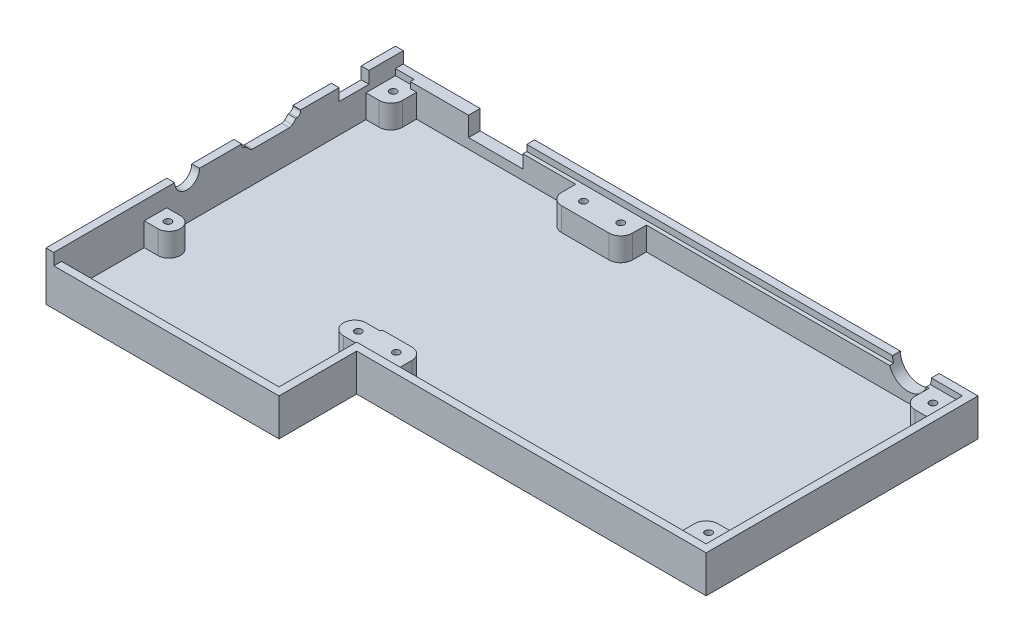
from build123d import *

# Parameters (mm, degrees)
SKETCH1_W           = 60
SKETCH1_H           = 90
BOSS_EXTRUDE1_DEPTH = 2
SKETCH2_W           = 60
SKETCH2_H           = 90
SKETCH2_W_2         = 56
SKETCH2_H_2         = 86
BOSS_EXTRUDE2_DEPTH = 10.6
CUT_EXTRUDE1_DEPTH  = 3
SKETCH15_W          = 90
SKETCH15_H          = 70
BOSS_EXTRUDE6_DEPTH = 2
BOSS_EXTRUDE7_DEPTH = 7.6
SKETCH4_R           = 0.9
BOSS_EXTRUDE3_DEPTH = 6
SKETCH18_W          = 2
SKETCH18_H          = 66
CUT_EXTRUDE11_DEPTH = 1.6
SKETCH7_W           = 14
SKETCH7_H           = 1
BOSS_EXTRUDE4_DEPTH = 2.6
SKETCH8_W           = 14
SKETCH8_H           = 2
CUT_EXTRUDE2_DEPTH  = 5
SKETCH9_W           = 15
SKETCH9_H           = 1
BOSS_EXTRUDE5_DEPTH = 7.6
SKETCH10_W          = 2
SKETCH10_H          = 7.7
CUT_EXTRUDE3_DEPTH  = 3.1
SKETCH11_W          = 2
SKETCH11_H          = 15.2
CUT_EXTRUDE4_DEPTH  = 1.22
SKETCH12_W          = 2
SKETCH12_H          = 12.76
CUT_EXTRUDE6_DEPTH  = 1.32
CUT_EXTRUDE7_REACH  = 157.202
FILLET6_R           = 1
CHAMFER2_SIZE       = 1.22
FILLET7_R           = 1
SKETCH19_W          = 88
SKETCH19_H          = 66
SKETCH19_W_2        = 86
SKETCH19_H_2        = 64
SKETCH19_R          = 0.9
BOSS_EXTRUDE9_DEPTH = 6
SKETCH20_W          = 4
SKETCH20_H          = 50.8
CUT_EXTRUDE12_DEPTH = 6
FILLET8_R           = 0.5
FILLET9_R           = 0.5
CUT_EXTRUDE13_DEPTH = 10


# Some blends are built 0.0001 mm under size
with BuildPart() as part:
    # Sketch1 → Boss-Extrude1 (new body)
    with BuildSketch(Plane(origin=(0, 0, 0), x_dir=(1, 0, 0), z_dir=(0, 1, 0))):
        Rectangle(SKETCH1_W, SKETCH1_H)
    extrude(amount=BOSS_EXTRUDE1_DEPTH)

    # Sketch2 → Boss-Extrude2 (add)
    with BuildSketch(Plane(origin=(0, 2, 0), x_dir=(1, 0, 0), z_dir=(0, 1, 0))):
        Rectangle(SKETCH2_W, SKETCH2_H)
        Rectangle(SKETCH2_W_2, SKETCH2_H_2, mode=Mode.SUBTRACT)
    extrude(amount=BOSS_EXTRUDE2_DEPTH)

    # Sketch3 → Cut-Extrude1 (cut)
    with BuildSketch(Plane(origin=(0, 12.6, 0), x_dir=(1, 0, 0), z_dir=(0, 1, 0))):
        Polygon((-28, -43), (28, -43), (28, 43), (-28, 43), (-28, 45), (30, 45), (30, -45), (-28, -45), align=None)
    extrude(amount=-CUT_EXTRUDE1_DEPTH, mode=Mode.SUBTRACT)

    # Sketch15 → Boss-Extrude6 (add)
    with BuildSketch(Plane.XZ):
        with Locations((75, -10)):
            Rectangle(SKETCH15_W, SKETCH15_H)
    extrude(amount=-BOSS_EXTRUDE6_DEPTH)

    # Sketch16 → Boss-Extrude7 (add)
    with BuildSketch(Plane(origin=(0, 2, 0), x_dir=(1, 0, 0), z_dir=(0, 1, 0))):
        Polygon((118, 43), (30, 43), (30, 45), (120, 45), (120, -25), (30, -25), (30, -23), (118, -23), align=None)
    extrude(amount=BOSS_EXTRUDE7_DEPTH)

    # Sketch4 → Boss-Extrude3 (add)
    # profile 1 of 5: a face of its own
    with BuildSketch(Plane(origin=(0, 2, 0), x_dir=(1, 0, 0), z_dir=(0, 1, 0))):
        with BuildLine():
            Line((24.2, -21.7), (27, -21.7))
            Line((27, -21.7), (27, -42))
            Line((27, -42), (-28, -42))
            Line((-28, -42), (-28, -43))
            Line((-28, -43), (28, -43))
            Line((28, -43), (28, 43))
            Line((28, 43), (5.8, 43))
            Line((5.8, 43), (5.8, 42))
            Line((5.8, 42), (19.4, 42))
            Line((19.4, 42), (27, 42))
            Line((27, 42), (27, 35.4))
            Line((27, 35.4), (27, -15.9))
            Line((27, -15.9), (24.2, -15.9))
            Line((24.2, -15.9), (24.2, -17.9))
            ThreePointArc((24.2, -17.9), (24.836396103, -18.163603897), (25.1, -18.8))
            ThreePointArc((25.1, -18.8), (24.836396103, -19.436396103), (24.2, -19.7))
            Line((24.2, -19.7), (24.2, -21.7))
        make_face()
    # profile 2 of 5: a face of its own
    with BuildSketch(Plane(origin=(0, 2, 0), x_dir=(1, 0, 0), z_dir=(0, 1, 0))):
        with BuildLine():
            Line((23.3, -21.7), (24.2, -21.7))
            Line((24.2, -21.7), (24.2, -19.7))
            ThreePointArc((24.2, -19.7), (23.3, -18.8), (24.2, -17.9))
            Line((24.2, -17.9), (24.2, -15.9))
            Line((24.2, -15.9), (23.3, -15.9))
            ThreePointArc((23.3, -15.9), (20.4, -18.8), (23.3, -21.7))
        make_face()
    # profile 3 of 5: a face of its own
    with BuildSketch(Plane(origin=(0, 2, 0), x_dir=(1, 0, 0), z_dir=(0, 1, 0))):
        with BuildLine():
            Line((-28, -15.9), (-28, -21.7))
            Line((-28, -21.7), (-24.5, -21.7))
            ThreePointArc((-24.5, -21.7), (-21.6, -18.8), (-24.5, -15.9))
            Line((-24.5, -15.9), (-28, -15.9))
        make_face()
        with Locations(Location((-24.8, -18.8, 0), (0, 0, 270))):
            Circle(SKETCH4_R, mode=Mode.SUBTRACT)
    # profile 4 of 5: a face of its own
    with BuildSketch(Plane(origin=(0, 2, 0), x_dir=(1, 0, 0), z_dir=(0, 1, 0))):
        with BuildLine():
            Line((-28, 43), (-28, 35.4))
            Line((-28, 35.4), (-24.6, 35.4))
            ThreePointArc((-24.6, 35.4), (-22.478679656, 36.278679656), (-21.6, 38.4))
            Line((-21.6, 38.4), (-21.6, 43))
            Line((-21.6, 43), (-28, 43))
        make_face()
        with Locations(Location((-24.8, 39.2, 0), (0, 0, 270))):
            Circle(SKETCH4_R, mode=Mode.SUBTRACT)
    # profile 5 of 5: a face of its own
    with BuildSketch(Plane(origin=(0, 2, 0), x_dir=(1, 0, 0), z_dir=(0, 1, 0))):
        with BuildLine():
            Line((22.4, 35.4), (27, 35.4))
            Line((27, 35.4), (27, 42))
            Line((27, 42), (19.4, 42))
            Line((19.4, 42), (19.4, 38.4))
            ThreePointArc((19.4, 38.4), (20.278679656, 36.278679656), (22.4, 35.4))
        make_face()
        with Locations(Location((24.2, 39.2, 0), (0, 0, 270))):
            Circle(SKETCH4_R, mode=Mode.SUBTRACT)
    extrude(amount=BOSS_EXTRUDE3_DEPTH)

    # Sketch18 → Cut-Extrude11 (cut)
    with BuildSketch(Plane(origin=(0, 9.6, 0), x_dir=(1, 0, 0), z_dir=(0, 1, 0))):
        with Locations((29, 10)):
            Rectangle(SKETCH18_W, SKETCH18_H)
    extrude(amount=-CUT_EXTRUDE11_DEPTH, mode=Mode.SUBTRACT)

    # Sketch7 → Boss-Extrude4 (add)
    with BuildSketch(Plane(origin=(0, 2, 0), x_dir=(1, 0, 0), z_dir=(0, 1, 0))):
        with Locations((-1.2, 42.5)):
            Rectangle(SKETCH7_W, SKETCH7_H)
    extrude(amount=BOSS_EXTRUDE4_DEPTH)

    # Sketch8 → Cut-Extrude2 (cut)
    with BuildSketch(Plane(origin=(0, 9.6, 0), x_dir=(1, 0, 0), z_dir=(0, 1, 0))):
        with Locations((-1.2, 44)):
            Rectangle(SKETCH8_W, SKETCH8_H)
    extrude(amount=-CUT_EXTRUDE2_DEPTH, mode=Mode.SUBTRACT)

    # Sketch9 → Boss-Extrude5 (add)
    with BuildSketch(Plane(origin=(0, 2, 0), x_dir=(1, 0, 0), z_dir=(0, 1, 0))):
        with Locations((-15.7, 42.5)):
            Rectangle(SKETCH9_W, SKETCH9_H)
    extrude(amount=BOSS_EXTRUDE5_DEPTH)

    # Sketch10 → Cut-Extrude3 (cut)
    with BuildSketch(Plane(origin=(0, 12.6, 0), x_dir=(1, 0, 0), z_dir=(0, 1, 0))):
        with Locations((-29, 32.32)):
            Rectangle(SKETCH10_W, SKETCH10_H)
    extrude(amount=-CUT_EXTRUDE3_DEPTH, mode=Mode.SUBTRACT)

    # Sketch11 → Cut-Extrude4 (cut)
    with BuildSketch(Plane(origin=(0, 12.6, 0), x_dir=(1, 0, 0), z_dir=(0, 1, 0))):
        with Locations((-29, 10.98)):
            Rectangle(SKETCH11_W, SKETCH11_H)
    extrude(amount=-CUT_EXTRUDE4_DEPTH, mode=Mode.SUBTRACT)

    # Sketch12 → Cut-Extrude6 (cut)
    with BuildSketch(Plane(origin=(0, 11.38, 0), x_dir=(1, 0, 0), z_dir=(0, 1, 0))):
        with Locations((-29, 10.98)):
            Rectangle(SKETCH12_W, SKETCH12_H)
    extrude(amount=-CUT_EXTRUDE6_DEPTH, mode=Mode.SUBTRACT)

    # Sketch13 → Cut-Extrude7 (cut, up to next)
    with BuildSketch(Plane(origin=(-28, 0, 0), x_dir=(0, 0, -1), z_dir=(1, 0, 0)), mode=Mode.PRIVATE) as cut_extrude7_sk1:
        with BuildLine():
            Line((-13.88, 12.6), (-7.48, 12.6))
            ThreePointArc((-7.48, 12.6), (-10.68, 9.4), (-13.88, 12.6))
        make_face()
    cut_extrude7_tool1 = extrude(cut_extrude7_sk1.sketch, amount=-CUT_EXTRUDE7_REACH, mode=Mode.PRIVATE) & part.part
    add(cut_extrude7_tool1.solids().sort_by_distance((-28, 11.241878, 10.68))[0], mode=Mode.SUBTRACT)

    # Fillet6
    fillet6_edges = [part.edges().sort_by_distance(p)[0] for p in [
        (-29, 11.38, -18.58),
        (-29, 11.38, -3.38),
    ]]
    fillet(fillet6_edges, radius=FILLET6_R)

    # Chamfer2
    chamfer2_edges = [part.edges().sort_by_distance(p)[0] for p in [
        (-29, 10.06, -17.36),
        (-29, 10.06, -4.6),
    ]]
    chamfer(chamfer2_edges, length=CHAMFER2_SIZE)

    # Fillet7
    # the kernel refuses this fillet: 1 mm, written as the material it adds along each edge
    with BuildSketch(Plane(origin=(-28, 10.06, -16.14), x_dir=(0, 0.7071067811865454, -0.7071067811865497), z_dir=(-1, 0, 0))) as fillet7_piece_1:
        with BuildLine():
            CenterArc((FILLET7_R * 0.414213562373, -FILLET7_R), FILLET7_R, 90, 45)
            Line((-FILLET7_R * 0.292893218813, -FILLET7_R * 0.292893218813), (0, 0))
            Line((0, 0), (FILLET7_R * 0.414213562373, 0))
        make_face()
    extrude(amount=2)
    with BuildSketch(Plane(origin=(-30, 10.06, -5.82), x_dir=(0, 0, -1), z_dir=(1, 0, 0))) as fillet7_piece_2:
        with BuildLine():
            CenterArc((FILLET7_R * 0.414213562373, FILLET7_R), FILLET7_R, 225, 45)
            Line((-FILLET7_R * 0.292893218813, FILLET7_R * 0.292893218813), (0, 0))
            Line((0, 0), (FILLET7_R * 0.414213562373, 0))
        make_face()
    extrude(amount=2)
    # the kernel refuses this fillet: 1 mm, written as the material it takes off along each edge
    with BuildSketch(Plane(origin=(-30.857621037, 11.38, -4.6), x_dir=(0, -1.0, 1.3882228699547056e-11), z_dir=(1, 0, 0)), Plane(origin=(-27.142378963, 11.38, -17.36), x_dir=(0, -1.0, -1.3891110483744069e-11), z_dir=(-1, 0, 0))) as fillet7_2_piece_1:
        with BuildLine():
            CenterArc((0.984822149, -0.465928927), FILLET7_R, 152.229642834, 20.707135911)
            Line((-0.007588926, -0.342964463), (-0.106830033, -0.330668017))
            ThreePointArc((-0.106830033, -0.330668017), (-0.1, -0.22), (-0.1, 0))
            Line((-0.1, 0), (0, 0.1))
            ThreePointArc((0, 0.1), (0.05, 0.1), (0.011517785, 0.046592893))
            Line((0.011517785, 0.046592893), (0.1, 0))
        make_face()
    extrude(amount=3.715242074, mode=Mode.SUBTRACT)

    # Sketch19 → Boss-Extrude9 (add)
    # profile 1 of 5: a face of its own
    with BuildSketch(Plane(origin=(0, 2, 0), x_dir=(1, 0, 0), z_dir=(0, 1, 0))):
        with Locations((74, 10)):
            Rectangle(SKETCH19_W, SKETCH19_H)
        with Locations((74, 10)):
            Rectangle(SKETCH19_W_2, SKETCH19_H_2, mode=Mode.SUBTRACT)
    # profile 2 of 5: a face of its own
    with BuildSketch(Plane(origin=(0, 2, 0), x_dir=(1, 0, 0), z_dir=(0, 1, 0))):
        with BuildLine():
            Line((37.6, 38.4), (37.6, 42))
            Line((37.6, 42), (31, 42))
            Line((31, 42), (31, 35.4))
            Line((31, 35.4), (34.6, 35.4))
            ThreePointArc((34.6, 35.4), (36.721320344, 36.278679656), (37.6, 38.4))
        make_face()
        with Locations(Location((33.8, 39.200675532, 0), (0, 0, 270))):
            Circle(SKETCH19_R, mode=Mode.SUBTRACT)
    # profile 3 of 5: a face of its own
    with BuildSketch(Plane(origin=(0, 2, 0), x_dir=(1, 0, 0), z_dir=(0, 1, 0))):
        with BuildLine():
            Line((117, 35.4), (117, 42))
            Line((117, 42), (110.4, 42))
            Line((110.4, 42), (110.4, 38.4))
            ThreePointArc((110.4, 38.4), (111.278679656, 36.278679656), (113.4, 35.4))
            Line((113.4, 35.4), (117, 35.4))
        make_face()
        with Locations(Location((114.2, 39.200675532, 0), (0, 0, 270))):
            Circle(SKETCH19_R, mode=Mode.SUBTRACT)
    # profile 4 of 5: a face of its own
    with BuildSketch(Plane(origin=(0, 2, 0), x_dir=(1, 0, 0), z_dir=(0, 1, 0))):
        with BuildLine():
            Line((117, -22), (117, -15.4))
            Line((117, -15.4), (113.4, -15.4))
            ThreePointArc((113.4, -15.4), (111.278679656, -16.278679656), (110.4, -18.4))
            Line((110.4, -18.4), (110.4, -22))
            Line((110.4, -22), (117, -22))
        make_face()
        with Locations(Location((114.2, -18.58, 0), (0, 0, 270))):
            Circle(SKETCH19_R, mode=Mode.SUBTRACT)
    # profile 5 of 5: a face of its own
    with BuildSketch(Plane(origin=(0, 2, 0), x_dir=(1, 0, 0), z_dir=(0, 1, 0))):
        with BuildLine():
            Line((34.6, -15.4), (31, -15.4))
            Line((31, -15.4), (31, -22))
            Line((31, -22), (37.6, -22))
            Line((37.6, -22), (37.6, -18.4))
            ThreePointArc((37.6, -18.4), (36.721320344, -16.278679656), (34.6, -15.4))
        make_face()
        with Locations(Location((33.8, -18.58, 0), (0, 0, 270))):
            Circle(SKETCH19_R, mode=Mode.SUBTRACT)
    extrude(amount=BOSS_EXTRUDE9_DEPTH)

    # Sketch20 → Cut-Extrude12 (cut)
    with BuildSketch(Plane(origin=(0, 8, 0), x_dir=(1, 0, 0), z_dir=(0, 1, 0))):
        with Locations((29, 10)):
            Rectangle(SKETCH20_W, SKETCH20_H)
    extrude(amount=-CUT_EXTRUDE12_DEPTH, mode=Mode.SUBTRACT)

    # Fillet8
    fillet8_edges = [part.edges().sort_by_distance(p)[0] for p in [
        (27, 5, 15.9),
    ]]
    fillet(fillet8_edges, radius=FILLET8_R - 0.0001)  # a hair under: the kernel refuses the full size

    # Fillet9
    fillet9_edges = [part.edges().sort_by_distance(p)[0] for p in [
        (27, 5, 15.4),
    ]]
    fillet(fillet9_edges, radius=FILLET9_R)

    # Sketch21 → Cut-Extrude13 (cut)
    with BuildSketch(Plane(origin=(0, 0, -45), x_dir=(-1, 0, 0), z_dir=(0, 0, -1))):
        with BuildLine():
            Line((-110, 9.6), (-100, 9.6))
            ThreePointArc((-100, 9.6), (-105, 4.6), (-110, 9.6))
        make_face()
    extrude(amount=-CUT_EXTRUDE13_DEPTH, mode=Mode.SUBTRACT)


solid = part.part
